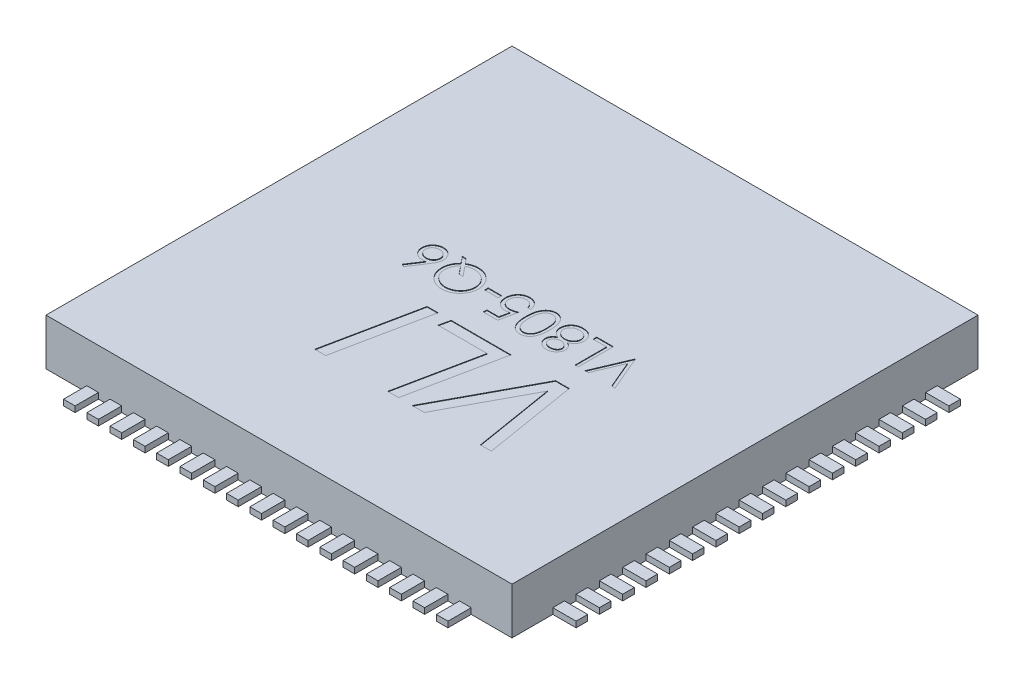
from build123d import *

# Parameters (mm, degrees)
BASES_W                = 8
BASES_H                = 8
BASE_DEPTH             = 0.8
TOPNAME_DEPTH          = 0.01
PARTNOADDITIONALS_W    = 0.230769231
PARTNOADDITIONALS_H    = 0.061538462
PARTNOADDITIONAL_DEPTH = 0.01
SOLDERCONNECTIONS_W    = 0.4
SOLDERCONNECTIONS_H    = 0.2
SOLDERCONNECTION_DEPTH = 0.1
SC_LP_COUNT            = 17
SC_LP_PITCH            = 0.4
SC_CP_COUNT            = 4
SC_CP_COPY_1_SKETCH_W  = 0.4
SC_CP_COPY_1_SKETCH_H  = 0.2
SC_CP_COPY_1_DEPTH     = 0.1
SC_CP_COPY_2_SKETCH_W  = 0.4
SC_CP_COPY_2_SKETCH_H  = 0.2
SC_CP_COPY_2_DEPTH     = 0.1
SC_CP_COPY_3_SKETCH_W  = 0.4
SC_CP_COPY_3_SKETCH_H  = 0.2
SC_CP_COPY_3_DEPTH     = 0.1
SC_CP_COPY_4_SKETCH_W  = 0.4
SC_CP_COPY_4_SKETCH_H  = 0.2
SC_CP_COPY_4_DEPTH     = 0.1
SC_CP_COPY_5_SKETCH_W  = 0.4
SC_CP_COPY_5_SKETCH_H  = 0.2
SC_CP_COPY_5_DEPTH     = 0.1
SC_CP_COPY_6_SKETCH_W  = 0.4
SC_CP_COPY_6_SKETCH_H  = 0.2
SC_CP_COPY_6_DEPTH     = 0.1
SC_CP_COPY_7_SKETCH_W  = 0.4
SC_CP_COPY_7_SKETCH_H  = 0.2
SC_CP_COPY_7_DEPTH     = 0.1
SC_CP_COPY_8_SKETCH_W  = 0.4
SC_CP_COPY_8_SKETCH_H  = 0.2
SC_CP_COPY_8_DEPTH     = 0.1
SC_CP_COPY_9_SKETCH_W  = 0.4
SC_CP_COPY_9_SKETCH_H  = 0.2
SC_CP_COPY_9_DEPTH     = 0.1
SC_CP_COPY_10_SKETCH_W = 0.4
SC_CP_COPY_10_SKETCH_H = 0.2
SC_CP_COPY_10_DEPTH    = 0.1
SC_CP_COPY_11_SKETCH_W = 0.4
SC_CP_COPY_11_SKETCH_H = 0.2
SC_CP_COPY_11_DEPTH    = 0.1
SC_CP_COPY_12_SKETCH_W = 0.4
SC_CP_COPY_12_SKETCH_H = 0.2
SC_CP_COPY_12_DEPTH    = 0.1
SC_CP_COPY_13_SKETCH_W = 0.4
SC_CP_COPY_13_SKETCH_H = 0.2
SC_CP_COPY_13_DEPTH    = 0.1
SC_CP_COPY_14_SKETCH_W = 0.4
SC_CP_COPY_14_SKETCH_H = 0.2
SC_CP_COPY_14_DEPTH    = 0.1
SC_CP_COPY_15_SKETCH_W = 0.4
SC_CP_COPY_15_SKETCH_H = 0.2
SC_CP_COPY_15_DEPTH    = 0.1
SC_CP_COPY_16_SKETCH_W = 0.4
SC_CP_COPY_16_SKETCH_H = 0.2
SC_CP_COPY_16_DEPTH    = 0.1
SC_CP_COPY_17_SKETCH_W = 0.4
SC_CP_COPY_17_SKETCH_H = 0.2
SC_CP_COPY_17_DEPTH    = 0.1
SC_CP_COPY_18_SKETCH_W = 0.4
SC_CP_COPY_18_SKETCH_H = 0.2
SC_CP_COPY_18_DEPTH    = 0.1
SC_CP_COPY_19_SKETCH_W = 0.4
SC_CP_COPY_19_SKETCH_H = 0.2
SC_CP_COPY_19_DEPTH    = 0.1
SC_CP_COPY_20_SKETCH_W = 0.4
SC_CP_COPY_20_SKETCH_H = 0.2
SC_CP_COPY_20_DEPTH    = 0.1
SC_CP_COPY_21_SKETCH_W = 0.4
SC_CP_COPY_21_SKETCH_H = 0.2
SC_CP_COPY_21_DEPTH    = 0.1
SC_CP_COPY_22_SKETCH_W = 0.4
SC_CP_COPY_22_SKETCH_H = 0.2
SC_CP_COPY_22_DEPTH    = 0.1
SC_CP_COPY_23_SKETCH_W = 0.4
SC_CP_COPY_23_SKETCH_H = 0.2
SC_CP_COPY_23_DEPTH    = 0.1
SC_CP_COPY_24_SKETCH_W = 0.4
SC_CP_COPY_24_SKETCH_H = 0.2
SC_CP_COPY_24_DEPTH    = 0.1
SC_CP_COPY_25_SKETCH_W = 0.4
SC_CP_COPY_25_SKETCH_H = 0.2
SC_CP_COPY_25_DEPTH    = 0.1
SC_CP_COPY_26_SKETCH_W = 0.4
SC_CP_COPY_26_SKETCH_H = 0.2
SC_CP_COPY_26_DEPTH    = 0.1
SC_CP_COPY_27_SKETCH_W = 0.4
SC_CP_COPY_27_SKETCH_H = 0.2
SC_CP_COPY_27_DEPTH    = 0.1
SC_CP_COPY_28_SKETCH_W = 0.4
SC_CP_COPY_28_SKETCH_H = 0.2
SC_CP_COPY_28_DEPTH    = 0.1
SC_CP_COPY_29_SKETCH_W = 0.4
SC_CP_COPY_29_SKETCH_H = 0.2
SC_CP_COPY_29_DEPTH    = 0.1
SC_CP_COPY_30_SKETCH_W = 0.4
SC_CP_COPY_30_SKETCH_H = 0.2
SC_CP_COPY_30_DEPTH    = 0.1
SC_CP_COPY_31_SKETCH_W = 0.4
SC_CP_COPY_31_SKETCH_H = 0.2
SC_CP_COPY_31_DEPTH    = 0.1
SC_CP_COPY_32_SKETCH_W = 0.4
SC_CP_COPY_32_SKETCH_H = 0.2
SC_CP_COPY_32_DEPTH    = 0.1
SC_CP_COPY_33_SKETCH_W = 0.4
SC_CP_COPY_33_SKETCH_H = 0.2
SC_CP_COPY_33_DEPTH    = 0.1
SC_CP_COPY_34_SKETCH_W = 0.4
SC_CP_COPY_34_SKETCH_H = 0.2
SC_CP_COPY_34_DEPTH    = 0.1
SC_CP_COPY_35_SKETCH_W = 0.4
SC_CP_COPY_35_SKETCH_H = 0.2
SC_CP_COPY_35_DEPTH    = 0.1
SC_CP_COPY_36_SKETCH_W = 0.4
SC_CP_COPY_36_SKETCH_H = 0.2
SC_CP_COPY_36_DEPTH    = 0.1
SC_CP_COPY_37_SKETCH_W = 0.4
SC_CP_COPY_37_SKETCH_H = 0.2
SC_CP_COPY_37_DEPTH    = 0.1
SC_CP_COPY_38_SKETCH_W = 0.4
SC_CP_COPY_38_SKETCH_H = 0.2
SC_CP_COPY_38_DEPTH    = 0.1
SC_CP_COPY_39_SKETCH_W = 0.4
SC_CP_COPY_39_SKETCH_H = 0.2
SC_CP_COPY_39_DEPTH    = 0.1
SC_CP_COPY_40_SKETCH_W = 0.4
SC_CP_COPY_40_SKETCH_H = 0.2
SC_CP_COPY_40_DEPTH    = 0.1
SC_CP_COPY_41_SKETCH_W = 0.4
SC_CP_COPY_41_SKETCH_H = 0.2
SC_CP_COPY_41_DEPTH    = 0.1
SC_CP_COPY_42_SKETCH_W = 0.4
SC_CP_COPY_42_SKETCH_H = 0.2
SC_CP_COPY_42_DEPTH    = 0.1
SC_CP_COPY_43_SKETCH_W = 0.4
SC_CP_COPY_43_SKETCH_H = 0.2
SC_CP_COPY_43_DEPTH    = 0.1
SC_CP_COPY_44_SKETCH_W = 0.4
SC_CP_COPY_44_SKETCH_H = 0.2
SC_CP_COPY_44_DEPTH    = 0.1
SC_CP_COPY_45_SKETCH_W = 0.4
SC_CP_COPY_45_SKETCH_H = 0.2
SC_CP_COPY_45_DEPTH    = 0.1
SC_CP_COPY_46_SKETCH_W = 0.4
SC_CP_COPY_46_SKETCH_H = 0.2
SC_CP_COPY_46_DEPTH    = 0.1
SC_CP_COPY_47_SKETCH_W = 0.4
SC_CP_COPY_47_SKETCH_H = 0.2
SC_CP_COPY_47_DEPTH    = 0.1
SC_CP_COPY_48_SKETCH_W = 0.4
SC_CP_COPY_48_SKETCH_H = 0.2
SC_CP_COPY_48_DEPTH    = 0.1


with BuildPart() as part:
    # BaseS → Base (new body)
    with BuildSketch(Plane(origin=(0, 0, 0), x_dir=(1, 0, 0), z_dir=(0, 1, 0))):
        Rectangle(BASES_W, BASES_H)
    extrude(amount=BASE_DEPTH)

    # TopNameS → TopName (cut)
    with BuildSketch(Plane(origin=(0, 0.8, 0), x_dir=(1, 0, 0), z_dir=(0, 1, 0))):
        Polygon((-0.669230769, -0.6), (-0.997435897, -2.2), (-1.18525641, -2.2), (-0.857051282, -0.6), align=None)
        Polygon((0.582051282, -0.6), (0.253846154, -2.2), (0.066346154, -2.2), (0.356410256, -0.784615385), (-0.484615385, -0.784615385), (-0.443589744, -0.6), align=None)
        with BuildLine():
            Line((1.582692308, -0.6), (1.845833333, -2.2))
            Line((1.845833333, -2.2), (1.658974359, -2.2))
            Line((1.658974359, -2.2), (1.501282051, -1.240064103))
            add(Edge.make_bspline(
                [(1.501282051, -1.240064103), (1.497882192, -1.219013983), (1.491253333, -1.177971615), (1.481270822, -1.118167783), (1.471926068, -1.061658816), (1.463384018, -1.008417747), (1.454955924, -0.958451018), (1.447246917, -0.91165871), (1.440328024, -0.868136506), (1.435599252, -0.840274101), (1.433333333, -0.826923077)],
                knots=[0, 0, 0, 0, 1.222255508, 2.383086792, 3.475457659, 4.505413456, 5.473947086, 6.380061867, 7.223762935, 8, 8, 8, 8], degree=3))
            add(Edge.make_bspline(
                [(1.433333333, -0.826923077), (1.424682368, -0.843057098), (1.407831804, -0.874483346), (1.383185106, -0.920334442), (1.359695574, -0.963496531), (1.337969804, -1.004460737), (1.317069979, -1.042664558), (1.297929186, -1.078667918), (1.279870901, -1.112049205), (1.26836855, -1.133542968), (1.262820513, -1.143910256)],
                knots=[0, 0, 0, 0, 1.220673892, 2.377659004, 3.470958565, 4.49719465, 5.469393223, 6.374526253, 7.21596997, 8, 8, 8, 8], degree=3))
            Line((1.262820513, -1.143910256), (0.694871795, -2.2))
            Line((0.694871795, -2.2), (0.488461538, -2.2))
            Line((0.488461538, -2.2), (1.348717949, -0.6))
            Line((1.348717949, -0.6), (1.582692308, -0.6))
        make_face()
    extrude(amount=-TOPNAME_DEPTH, mode=Mode.SUBTRACT)

    # PartNoAdditionalS → PartNoAdditional (cut)
    # profile 1 of 8: a face of its own
    with BuildSketch(Plane(origin=(0, 0.8, 0), x_dir=(1, 0, 0), z_dir=(0, 1, 0))):
        Polygon((1.969230769, -0.2), (1.911538462, -0.2), (1.711538462, 0.272836538), (1.511538462, -0.2), (1.453846154, -0.2), (1.707692308, 0.4), (1.715384615, 0.4), align=None)
    # profile 2 of 8: a face of its own
    with BuildSketch(Plane(origin=(0, 0.8, 0), x_dir=(1, 0, 0), z_dir=(0, 1, 0))):
        Polygon((1.338461538, -0.2), (1.284615385, -0.2), (1.284615385, 0.338461538), (1.053846154, 0.338461538), (1.053846154, 0.4), (1.338461538, 0.4), align=None)
    # profile 3 of 8: a face of its own
    with BuildSketch(Plane(origin=(0, 0.8, 0), x_dir=(1, 0, 0), z_dir=(0, 1, 0))):
        with BuildLine():
            add(Edge.make_bspline(
                [(0.715985577, 0.065745192), (0.71111349, 0.068305522), (0.701581569, 0.073314639), (0.688002988, 0.08140452), (0.675329538, 0.08963569), (0.663795622, 0.098304095), (0.653288162, 0.107225473), (0.643774822, 0.116376218), (0.635153293, 0.12572739), (0.627719761, 0.13551939), (0.621124306, 0.145578087), (0.615537148, 0.156027453), (0.610660977, 0.166716492), (0.60683379, 0.177807486), (0.603674009, 0.189148282), (0.601501525, 0.200891054), (0.600332782, 0.212956871), (0.60011186, 0.221111446), (0.6, 0.225240385)],
                knots=[0, 0, 0, 0, 1.264219729, 2.473363326, 3.62979159, 4.734286947, 5.785533755, 6.79450939, 7.765315851, 8.704182021, 9.615576613, 10.525715488, 11.423813905, 12.311666436, 13.218214638, 14.126256791, 15.051260205, 16, 16, 16, 16], degree=3))
            add(Edge.make_bspline(
                [(0.6, 0.225240385), (0.600131502, 0.231017388), (0.600391795, 0.242452244), (0.602682568, 0.259325102), (0.606066344, 0.275778429), (0.611206623, 0.291625708), (0.617531981, 0.307001961), (0.625513747, 0.32170003), (0.634522202, 0.336141826), (0.641766894, 0.345024578), (0.645432692, 0.349519231)],
                knots=[0, 0, 0, 0, 1.02531512, 2.029483338, 3.018748588, 4.004195107, 4.983200899, 5.966616707, 6.971112471, 8, 8, 8, 8], degree=3))
            add(Edge.make_bspline(
                [(0.645432692, 0.349519231), (0.650204659, 0.354763878), (0.659689625, 0.365188362), (0.675938127, 0.378722787), (0.69377045, 0.390096969), (0.713117592, 0.399366436), (0.733927838, 0.406581155), (0.756196753, 0.411765587), (0.779967751, 0.414735146), (0.796305832, 0.415164401), (0.8046875, 0.415384615)],
                knots=[0, 0, 0, 0, 0.954267603, 1.896743057, 2.838368354, 3.796610408, 4.779680527, 5.799409237, 6.871065594, 8, 8, 8, 8], degree=3))
            add(Edge.make_bspline(
                [(0.8046875, 0.415384615), (0.812746752, 0.415186518), (0.828429239, 0.414801039), (0.851258859, 0.412203579), (0.872565487, 0.407605081), (0.892450142, 0.401441245), (0.910720545, 0.393221623), (0.927409916, 0.383146766), (0.942762869, 0.371444131), (0.95629776, 0.357832081), (0.968310723, 0.343249423), (0.978872475, 0.328209591), (0.987601729, 0.312723533), (0.995125645, 0.297026807), (1.000724899, 0.280801364), (1.00469626, 0.264213715), (1.007190828, 0.247310982), (1.007524464, 0.235905882), (1.007692308, 0.230168269)],
                knots=[0, 0, 0, 0, 1.256864279, 2.445730223, 3.576845088, 4.651810441, 5.686528262, 6.692706664, 7.686234615, 8.689148594, 9.678739427, 10.630299996, 11.55097961, 12.448208961, 13.341360817, 14.221834469, 15.105450545, 16, 16, 16, 16], degree=3))
            add(Edge.make_bspline(
                [(1.007692308, 0.230168269), (1.007593218, 0.225958131), (1.007397382, 0.217637413), (1.006042616, 0.205344249), (1.003862723, 0.193379705), (1.000908767, 0.181696556), (0.996868717, 0.170356449), (0.992075776, 0.159300901), (0.986433334, 0.148530233), (0.979719208, 0.138208424), (0.972321981, 0.127969852), (0.963540792, 0.118322908), (0.953961079, 0.108700945), (0.943012556, 0.099689074), (0.931286526, 0.090542787), (0.918236114, 0.082026552), (0.904296473, 0.073475718), (0.8943865, 0.068366247), (0.889302885, 0.065745192)],
                knots=[0, 0, 0, 0, 0.941575622, 1.860885767, 2.762557628, 3.660168386, 4.552890429, 5.45184204, 6.353736508, 7.268493418, 8.204037487, 9.175167802, 10.182660057, 11.238220596, 12.344046335, 13.507168087, 14.721227736, 16, 16, 16, 16], degree=3))
            add(Edge.make_bspline(
                [(0.889302885, 0.065745192), (0.896252934, 0.061939639), (0.909689133, 0.054582545), (0.927650078, 0.04123413), (0.942864518, 0.026515018), (0.955170763, 0.01040306), (0.964887167, -0.006572201), (0.971756775, -0.0243214), (0.976240725, -0.042646574), (0.976694953, -0.055142523), (0.976923077, -0.061418269)],
                knots=[0, 0, 0, 0, 1.16701039, 2.256125286, 3.287752239, 4.277689688, 5.235169525, 6.160862735, 7.076343936, 8, 8, 8, 8], degree=3))
            add(Edge.make_bspline(
                [(0.976923077, -0.061418269), (0.976642221, -0.067811841), (0.976077652, -0.080664036), (0.971528169, -0.099801057), (0.964058156, -0.11860698), (0.954071862, -0.137038224), (0.941363068, -0.154254951), (0.926320434, -0.16982135), (0.908962883, -0.183334548), (0.889671928, -0.194757641), (0.868949253, -0.204099212), (0.847048108, -0.210476562), (0.824358825, -0.214670951), (0.808913213, -0.215144506), (0.801081731, -0.215384615)],
                knots=[0, 0, 0, 0, 0.888724595, 1.786491426, 2.720083884, 3.697804067, 4.69440576, 5.687697823, 6.7000873, 7.744853364, 8.800284131, 9.853047784, 10.91141782, 12, 12, 12, 12], degree=3))
            add(Edge.make_bspline(
                [(0.801081731, -0.215384615), (0.793452221, -0.215137742), (0.778407696, -0.214650936), (0.756260764, -0.210550742), (0.735052168, -0.203779522), (0.714900772, -0.194557097), (0.696235355, -0.183065684), (0.679624862, -0.169403776), (0.664933692, -0.15400699), (0.652796135, -0.136733479), (0.643059249, -0.118303464), (0.636047571, -0.099185454), (0.63161473, -0.079608644), (0.631051448, -0.066368959), (0.630769231, -0.059735577)],
                knots=[0, 0, 0, 0, 1.072634126, 2.115112298, 3.156050586, 4.19761425, 5.225177188, 6.230426315, 7.215180151, 8.209739481, 9.190420596, 10.139012357, 11.067603024, 12, 12, 12, 12], degree=3))
            add(Edge.make_bspline(
                [(0.630769231, -0.059735577), (0.631016643, -0.053225863), (0.631502547, -0.040441155), (0.635536223, -0.021830867), (0.64243506, -0.004438039), (0.651741614, 0.012004966), (0.663956678, 0.027235391), (0.678833619, 0.041328874), (0.696179391, 0.054561054), (0.709235938, 0.061933813), (0.715985577, 0.065745192)],
                knots=[0, 0, 0, 0, 0.975463758, 1.915755378, 2.838359076, 3.772025586, 4.738400888, 5.753889765, 6.838863581, 8, 8, 8, 8], degree=3))
        make_face()
        with BuildLine():
            add(Edge.make_bspline(
                [(0.804086538, -0.153846154), (0.808295395, -0.15373484), (0.816529759, -0.153517061), (0.828601185, -0.152370517), (0.840089575, -0.150168185), (0.851057751, -0.147151019), (0.861543286, -0.143397061), (0.871305729, -0.138451094), (0.880673152, -0.13295363), (0.889338249, -0.126505356), (0.897182362, -0.119470149), (0.904188538, -0.112122984), (0.909896397, -0.104247269), (0.914807077, -0.096237015), (0.918453943, -0.087759978), (0.921044551, -0.079001765), (0.922877945, -0.069906902), (0.923010081, -0.063711087), (0.923076923, -0.060576923)],
                knots=[0, 0, 0, 0, 1.20353747, 2.354645537, 3.462130888, 4.543058862, 5.604822423, 6.639552563, 7.666902586, 8.706944258, 9.720926464, 10.677177239, 11.602682187, 12.496457588, 13.358248655, 14.231532794, 15.105417644, 16, 16, 16, 16], degree=3))
            add(Edge.make_bspline(
                [(0.923076923, -0.060576923), (0.922955019, -0.057444533), (0.92271412, -0.051254481), (0.920970485, -0.042076865), (0.918055112, -0.033175462), (0.914057508, -0.024467174), (0.908927332, -0.015974355), (0.90270083, -0.00766446), (0.895107837, 0.000242762), (0.88672288, 0.007971655), (0.877563799, 0.015092398), (0.867939272, 0.021453035), (0.857779056, 0.026523679), (0.847387428, 0.030969598), (0.836544629, 0.034304552), (0.825325421, 0.036707191), (0.813741789, 0.038193372), (0.805893822, 0.038371442), (0.801923077, 0.038461538)],
                knots=[0, 0, 0, 0, 0.873213166, 1.72559466, 2.594724523, 3.479581045, 4.391597569, 5.35687048, 6.368548091, 7.443976143, 8.534559525, 9.600545123, 10.654815915, 11.696401765, 12.749428718, 13.812189468, 14.893058657, 16, 16, 16, 16], degree=3))
            add(Edge.make_bspline(
                [(0.801923077, 0.038461538), (0.796822754, 0.038312659), (0.786672483, 0.03801637), (0.771714827, 0.035236439), (0.757134569, 0.030918943), (0.743207591, 0.024791038), (0.730183153, 0.01731965), (0.718428599, 0.008508792), (0.708435835, -0.001848451), (0.699934536, -0.013151281), (0.693287723, -0.025140854), (0.688196161, -0.037221928), (0.68519768, -0.049494014), (0.684807902, -0.057717255), (0.684615385, -0.061778846)],
                knots=[0, 0, 0, 0, 1.076561449, 2.142489767, 3.202892658, 4.283174188, 5.348766409, 6.369549039, 7.375093932, 8.378927502, 9.349008457, 10.26378795, 11.142457041, 12, 12, 12, 12], degree=3))
            add(Edge.make_bspline(
                [(0.684615385, -0.061778846), (0.684704881, -0.064629964), (0.684882517, -0.070289025), (0.686405644, -0.078673297), (0.688781258, -0.086872056), (0.69224405, -0.094837173), (0.69643295, -0.102753684), (0.701772438, -0.110373241), (0.707960599, -0.117926433), (0.715086769, -0.125164643), (0.723137871, -0.131960069), (0.732179033, -0.137850639), (0.742130469, -0.142762719), (0.752858765, -0.146889473), (0.764477295, -0.149954448), (0.776886027, -0.152260953), (0.790196926, -0.153558306), (0.799356251, -0.153748123), (0.804086538, -0.153846154)],
                knots=[0, 0, 0, 0, 0.814035228, 1.61574325, 2.427118093, 3.24780647, 4.092880925, 4.981933388, 5.900917883, 6.880367106, 7.87994501, 8.905470125, 9.95492938, 11.0455354, 12.184050453, 13.382997595, 14.64846247, 16, 16, 16, 16], degree=3))
        make_face(mode=Mode.SUBTRACT)
        with BuildLine():
            add(Edge.make_bspline(
                [(0.800600962, 0.1), (0.805936796, 0.100094937), (0.816404401, 0.10028118), (0.831740081, 0.102353282), (0.846457013, 0.105239718), (0.860510017, 0.109611378), (0.873826957, 0.115299502), (0.886595245, 0.122044643), (0.898614934, 0.13012936), (0.909832299, 0.139357609), (0.920102098, 0.14935804), (0.929144799, 0.159919831), (0.936784599, 0.170899567), (0.942984383, 0.182311134), (0.947794011, 0.194129389), (0.951343591, 0.20636123), (0.953404472, 0.219040776), (0.953698106, 0.227636996), (0.953846154, 0.231971154)],
                knots=[0, 0, 0, 0, 1.140332253, 2.237053636, 3.304055028, 4.344690294, 5.377465719, 6.397042765, 7.428360044, 8.469453732, 9.499453352, 10.490108612, 11.438398528, 12.354680514, 13.261581007, 14.161901135, 15.073242693, 16, 16, 16, 16], degree=3))
            add(Edge.make_bspline(
                [(0.953846154, 0.231971154), (0.953608134, 0.237358368), (0.953134179, 0.248085597), (0.949508982, 0.263899438), (0.943555361, 0.279204427), (0.935203133, 0.293784711), (0.925015367, 0.307463512), (0.91263015, 0.319554707), (0.898349448, 0.32989553), (0.882290582, 0.338538336), (0.86468692, 0.345383556), (0.845647251, 0.350280844), (0.825300542, 0.353358996), (0.81126931, 0.353681209), (0.804086538, 0.353846154)],
                knots=[0, 0, 0, 0, 0.899105568, 1.790333855, 2.694925079, 3.632758987, 4.588257081, 5.534574046, 6.511571685, 7.523527334, 8.572244311, 9.657983075, 10.801090915, 12, 12, 12, 12], degree=3))
            add(Edge.make_bspline(
                [(0.804086538, 0.353846154), (0.798472579, 0.353737099), (0.787534785, 0.353524626), (0.771571804, 0.35168818), (0.756543053, 0.348688389), (0.742304553, 0.344620994), (0.728962282, 0.339229305), (0.716534428, 0.332532311), (0.704851758, 0.324882897), (0.694413565, 0.315826651), (0.684922681, 0.306135908), (0.676609415, 0.295931235), (0.669573836, 0.285314834), (0.663902483, 0.274292917), (0.659398887, 0.262905991), (0.656152307, 0.251107311), (0.654151348, 0.238850533), (0.653948816, 0.230536468), (0.653846154, 0.226322115)],
                knots=[0, 0, 0, 0, 1.224631902, 2.385975653, 3.500340538, 4.565441647, 5.612488581, 6.63322211, 7.641830068, 8.652595074, 9.641693811, 10.598750962, 11.520088299, 12.415429315, 13.298523938, 14.187139574, 15.081071174, 16, 16, 16, 16], degree=3))
            add(Edge.make_bspline(
                [(0.653846154, 0.226322115), (0.654000416, 0.222228391), (0.654304595, 0.214156281), (0.656262907, 0.202203065), (0.659624682, 0.190607433), (0.664526716, 0.179421683), (0.670546663, 0.168515698), (0.677983219, 0.157981033), (0.686745746, 0.147788519), (0.696812797, 0.138148009), (0.707723207, 0.129235795), (0.71928586, 0.121315705), (0.731553449, 0.114842543), (0.74428296, 0.109404631), (0.757602716, 0.105166831), (0.771448473, 0.102195231), (0.785846459, 0.100327582), (0.795627231, 0.100110427), (0.800600962, 0.1)],
                knots=[0, 0, 0, 0, 0.917336384, 1.808827106, 2.706624561, 3.615530867, 4.539869921, 5.493819324, 6.499753197, 7.547410123, 8.613069608, 9.653934021, 10.682176708, 11.716048074, 12.752411263, 13.808993382, 14.885826486, 16, 16, 16, 16], degree=3))
        make_face(mode=Mode.SUBTRACT)
    # profile 4 of 8: a face of its own
    with BuildSketch(Plane(origin=(0, 0.8, 0), x_dir=(1, 0, 0), z_dir=(0, 1, 0))):
        with BuildLine():
            add(Edge.make_bspline(
                [(0.546153846, 0.100240385), (0.546097614, 0.09062369), (0.545988384, 0.071943121), (0.544773226, 0.044722897), (0.542754596, 0.019186847), (0.539988188, -0.00466625), (0.536621679, -0.026842554), (0.53212759, -0.047282792), (0.527016844, -0.066081602), (0.521093498, -0.083300172), (0.514410119, -0.099170865), (0.50713482, -0.113985804), (0.498983885, -0.127727292), (0.490405584, -0.140597792), (0.481099694, -0.152467781), (0.471098575, -0.163283912), (0.460490319, -0.173213797), (0.449224729, -0.182094152), (0.437409182, -0.189832196), (0.425393195, -0.196846558), (0.41283405, -0.202395113), (0.400041524, -0.207139765), (0.38691255, -0.210898172), (0.37344141, -0.213512438), (0.359616014, -0.215147979), (0.350285069, -0.215304988), (0.345552885, -0.215384615)],
                knots=[0, 0, 0, 0, 1.64625301, 3.197870201, 4.6634513, 6.030635694, 7.308242971, 8.501545196, 9.611429483, 10.641742253, 11.616230371, 12.55791849, 13.464870342, 14.34944951, 15.20427819, 16.044004467, 16.869007726, 17.689551165, 18.496129964, 19.285613293, 20.0683943, 20.843080271, 21.620342827, 22.403213977, 23.190190624, 24, 24, 24, 24], degree=3))
            add(Edge.make_bspline(
                [(0.345552885, -0.215384615), (0.340778774, -0.215318401), (0.331279975, -0.215186658), (0.317287092, -0.213332295), (0.303537942, -0.210938815), (0.290241125, -0.207100066), (0.277145225, -0.202506506), (0.264575911, -0.196445377), (0.252089419, -0.189853428), (0.240252993, -0.181811804), (0.228712984, -0.172924487), (0.21789543, -0.16283511), (0.207523806, -0.151822898), (0.197989843, -0.139642246), (0.188884931, -0.126479919), (0.1805547, -0.112225581), (0.172825897, -0.096910819), (0.16555324, -0.080606631), (0.159193494, -0.062877507), (0.153539171, -0.043834029), (0.148904497, -0.023303747), (0.145071703, -0.00140103), (0.142096725, 0.021982629), (0.139931587, 0.046799852), (0.138787499, 0.073066165), (0.138572083, 0.091024659), (0.138461538, 0.100240385)],
                knots=[0, 0, 0, 0, 0.810910589, 1.61342667, 2.396193133, 3.181089899, 3.963115317, 4.752255436, 5.550715454, 6.36105385, 7.181178335, 8.024612154, 8.872680183, 9.750181803, 10.651284446, 11.591556747, 12.554036451, 13.566402641, 14.62422919, 15.753422176, 16.94128843, 18.199818041, 19.531985927, 20.947085226, 22.433341622, 24, 24, 24, 24], degree=3))
            add(Edge.make_bspline(
                [(0.138461538, 0.100240385), (0.138574653, 0.109415797), (0.138795545, 0.127333733), (0.139905549, 0.153483565), (0.142154766, 0.178165367), (0.144896154, 0.201414898), (0.1488487, 0.223201766), (0.153249064, 0.243642977), (0.158861976, 0.262546459), (0.16507087, 0.280123613), (0.172242332, 0.296358734), (0.179912929, 0.311610282), (0.188367511, 0.325783724), (0.197297717, 0.33902948), (0.207012176, 0.351105668), (0.217243441, 0.362241065), (0.228165942, 0.372347971), (0.239765356, 0.381340223), (0.251713658, 0.389442423), (0.264202584, 0.396269421), (0.276939782, 0.402221171), (0.290057734, 0.407005681), (0.303472792, 0.410787855), (0.317233264, 0.41336255), (0.331281846, 0.415177386), (0.3407794, 0.4153153), (0.345552885, 0.415384615)],
                knots=[0, 0, 0, 0, 1.561431216, 3.049195289, 4.452146966, 5.778046447, 7.031138842, 8.218704273, 9.334037798, 10.384210803, 11.388620812, 12.352076869, 13.287433199, 14.19507451, 15.06813243, 15.922055533, 16.766344942, 17.596869952, 18.417486629, 19.220035357, 20.016159057, 20.807716045, 21.59340902, 22.384936649, 23.188266813, 24, 24, 24, 24], degree=3))
            add(Edge.make_bspline(
                [(0.345552885, 0.415384615), (0.350284904, 0.415304283), (0.359615524, 0.415145882), (0.373443302, 0.413520534), (0.38689491, 0.41087014), (0.39999724, 0.407270918), (0.412777102, 0.402696519), (0.425109318, 0.396878059), (0.437156706, 0.390129525), (0.448864472, 0.382451903), (0.460008798, 0.373653174), (0.470656117, 0.363923452), (0.480527743, 0.353011992), (0.489769456, 0.341092949), (0.498418934, 0.328190049), (0.506535352, 0.314343362), (0.513788495, 0.2993841), (0.520623412, 0.283427252), (0.526648443, 0.266082164), (0.531909389, 0.247218934), (0.536344845, 0.226708896), (0.539877747, 0.20455107), (0.542771982, 0.180779756), (0.544771236, 0.155357074), (0.545987776, 0.128337477), (0.546097479, 0.10977699), (0.546153846, 0.100240385)],
                knots=[0, 0, 0, 0, 0.810976328, 1.599087026, 2.383086309, 3.159618043, 3.926613167, 4.707144544, 5.494386734, 6.292609454, 7.104690378, 7.92621526, 8.762510248, 9.62398222, 10.509836085, 11.424023232, 12.373226806, 13.358118208, 14.398657954, 15.5185989, 16.713620699, 17.994156382, 19.364120462, 20.818119981, 22.365111093, 24, 24, 24, 24], degree=3))
        make_face()
        with BuildLine():
            add(Edge.make_bspline(
                [(0.492307692, 0.1), (0.492286767, 0.108014031), (0.492246154, 0.12356769), (0.491215884, 0.146129889), (0.489781854, 0.167209009), (0.48797776, 0.186796823), (0.485275876, 0.204824875), (0.482210416, 0.221368105), (0.478533608, 0.23639592), (0.474161754, 0.250039555), (0.46918205, 0.262492509), (0.463753731, 0.274085667), (0.457873689, 0.284960044), (0.451407017, 0.295076404), (0.444261067, 0.304378245), (0.436595338, 0.312909745), (0.428365258, 0.320636166), (0.416974843, 0.329805862), (0.402010524, 0.339393109), (0.38305971, 0.347639053), (0.363578312, 0.352854598), (0.350351775, 0.353516018), (0.34375, 0.353846154)],
                knots=[0, 0, 0, 0, 1.459193451, 2.832007961, 4.111736495, 5.306635028, 6.412683014, 7.430020708, 8.369596877, 9.227877302, 10.036669781, 10.810175692, 11.557788084, 12.286326232, 12.994037279, 13.69140682, 14.37267704, 15.047194847, 16.352618509, 17.594157723, 18.799169539, 20, 20, 20, 20], degree=3))
            add(Edge.make_bspline(
                [(0.34375, 0.353846154), (0.337110317, 0.35355667), (0.323854503, 0.35297873), (0.304386365, 0.347934696), (0.285642967, 0.339734698), (0.270850876, 0.330366394), (0.259628545, 0.321387533), (0.251584963, 0.313741016), (0.244203084, 0.305176678), (0.237201533, 0.295936931), (0.230779992, 0.285844468), (0.224940593, 0.274948037), (0.21961202, 0.263217318), (0.216576183, 0.25502822), (0.215024038, 0.250841346)],
                knots=[0, 0, 0, 0, 1.353621445, 2.702441307, 4.075953605, 5.516772412, 6.261413105, 7.007624062, 7.778524365, 8.566925914, 9.372323995, 10.217594641, 11.088702136, 12, 12, 12, 12], degree=3))
            add(Edge.make_bspline(
                [(0.215024038, 0.250841346), (0.213215164, 0.245487677), (0.209542373, 0.234617431), (0.204808926, 0.217755091), (0.201081143, 0.200063188), (0.197727423, 0.181647454), (0.195438328, 0.162372077), (0.193595846, 0.142296697), (0.192510585, 0.121406178), (0.192376057, 0.10721275), (0.192307692, 0.1)],
                knots=[0, 0, 0, 0, 0.884706709, 1.796334032, 2.740027952, 3.714592787, 4.726048262, 5.777819803, 6.87074269, 8, 8, 8, 8], degree=3))
            add(Edge.make_bspline(
                [(0.192307692, 0.1), (0.192383091, 0.092787405), (0.192530604, 0.078676281), (0.193499782, 0.058031694), (0.195057171, 0.038389521), (0.197165062, 0.019731943), (0.20005875, 0.002092169), (0.203533784, -0.014555042), (0.207607856, -0.03020521), (0.212280959, -0.044898667), (0.217547407, -0.058582699), (0.223365511, -0.071286762), (0.229573322, -0.083079375), (0.236320342, -0.093922607), (0.243511114, -0.103879731), (0.251403833, -0.112721539), (0.25949716, -0.12087816), (0.271007583, -0.130022334), (0.285954215, -0.139419481), (0.304681168, -0.147832062), (0.324062756, -0.152810855), (0.337192317, -0.153501303), (0.34375, -0.153846154)],
                knots=[0, 0, 0, 0, 1.313528337, 2.569860077, 3.762944266, 4.901481389, 5.988248151, 7.017139294, 7.997571128, 8.932104357, 9.823695246, 10.66607014, 11.475539426, 12.248954257, 12.990316782, 13.708962568, 14.405488541, 15.08007697, 16.381737273, 17.610043218, 18.806313575, 20, 20, 20, 20], degree=3))
            add(Edge.make_bspline(
                [(0.34375, -0.153846154), (0.350387389, -0.153500895), (0.363674258, -0.152809748), (0.3832586, -0.147849628), (0.402097661, -0.139479314), (0.417012796, -0.130010713), (0.428361175, -0.120913672), (0.436436885, -0.11314954), (0.444058247, -0.104697827), (0.451169964, -0.095438161), (0.457597181, -0.085341091), (0.46354869, -0.074545547), (0.4689337, -0.06296961), (0.473932201, -0.05052354), (0.478257667, -0.036857485), (0.482146765, -0.021832667), (0.485148564, -0.005181849), (0.487813897, 0.012930862), (0.489828586, 0.032541965), (0.49120589, 0.053670984), (0.492249283, 0.076311833), (0.492287833, 0.091945797), (0.492307692, 0.1)],
                knots=[0, 0, 0, 0, 1.207779899, 2.417760083, 3.652287919, 4.947299644, 5.621638849, 6.297435916, 6.984320042, 7.691843698, 8.42018894, 9.161205785, 9.934506883, 10.743085206, 11.601138371, 12.542248028, 13.566483018, 14.679455109, 15.87477181, 17.154161492, 18.533899613, 20, 20, 20, 20], degree=3))
        make_face(mode=Mode.SUBTRACT)
    # profile 5 of 8: a face of its own
    with BuildSketch(Plane(origin=(0, 0.8, 0), x_dir=(1, 0, 0), z_dir=(0, 1, 0))):
        with BuildLine():
            Line((-0.292307692, -0.2), (-0.292307692, -0.138461538))
            Line((-0.292307692, -0.138461538), (-0.088221154, -0.138461538))
            Line((-0.088221154, -0.138461538), (-0.055889423, 0.019350962))
            add(Edge.make_bspline(
                [(-0.055889423, 0.019350962), (-0.062241859, 0.017597201), (-0.074548698, 0.014199566), (-0.092713246, 0.010427149), (-0.109957623, 0.008153072), (-0.121147687, 0.007842562), (-0.1265625, 0.007692308)],
                knots=[0, 0, 0, 0, 1.100273476, 2.13160584, 3.095893838, 4, 4, 4, 4], degree=3))
            add(Edge.make_bspline(
                [(-0.1265625, 0.007692308), (-0.133263776, 0.007832574), (-0.14644016, 0.008108373), (-0.165689227, 0.010912604), (-0.184155577, 0.014977047), (-0.201573596, 0.021228935), (-0.218224099, 0.028912811), (-0.233881345, 0.038465207), (-0.248618883, 0.049750007), (-0.262404499, 0.062535717), (-0.274832716, 0.076771204), (-0.285675668, 0.09208986), (-0.294943792, 0.108320751), (-0.302337009, 0.125613174), (-0.308331292, 0.143804166), (-0.312294719, 0.163046369), (-0.314939101, 0.183179688), (-0.315234156, 0.196946275), (-0.315384615, 0.203966346)],
                knots=[0, 0, 0, 0, 1.052656913, 2.069786496, 3.052102726, 4.020122636, 4.972424848, 5.930457368, 6.896570172, 7.885826804, 8.881139003, 9.861434336, 10.831623367, 11.813212553, 12.812997731, 13.836986694, 14.897002833, 16, 16, 16, 16], degree=3))
            add(Edge.make_bspline(
                [(-0.315384615, 0.203966346), (-0.315270515, 0.208855846), (-0.315043857, 0.218568767), (-0.313893379, 0.232993841), (-0.311671064, 0.247111867), (-0.308719389, 0.260894882), (-0.304794495, 0.274363454), (-0.300153112, 0.287549361), (-0.294597689, 0.300430788), (-0.288258192, 0.31294364), (-0.281045507, 0.32484163), (-0.273347951, 0.336263397), (-0.264960286, 0.346877583), (-0.256029345, 0.356861606), (-0.246383645, 0.365928308), (-0.236259892, 0.37445591), (-0.225431698, 0.382082701), (-0.214089957, 0.389097159), (-0.202242624, 0.395377757), (-0.189769352, 0.400616865), (-0.176944021, 0.405208998), (-0.163652304, 0.408943342), (-0.149919955, 0.411840654), (-0.135699685, 0.413813684), (-0.121062849, 0.415249235), (-0.111141438, 0.415339181), (-0.106129808, 0.415384615)],
                knots=[0, 0, 0, 0, 1.056281413, 2.098288097, 3.122646807, 4.141030392, 5.140675379, 6.150604744, 7.15845591, 8.168533554, 9.177684096, 10.161739049, 11.141561652, 12.097360316, 13.052218386, 13.998410789, 14.954052752, 15.909851415, 16.877523809, 17.846742625, 18.829312613, 19.818263486, 20.826374662, 21.858017533, 22.918014209, 24, 24, 24, 24], degree=3))
            add(Edge.make_bspline(
                [(-0.106129808, 0.415384615), (-0.100151537, 0.415265857), (-0.088389994, 0.415032214), (-0.071155618, 0.412599449), (-0.054584295, 0.409091368), (-0.038744753, 0.403896746), (-0.023711483, 0.397084835), (-0.00926641, 0.389043319), (0.004326047, 0.379337527), (0.017162322, 0.368315408), (0.028937437, 0.356090496), (0.039777757, 0.343093575), (0.049164116, 0.329036378), (0.057319936, 0.314153424), (0.064257903, 0.298405913), (0.069713157, 0.281757293), (0.074114816, 0.264288437), (0.075977164, 0.25226216), (0.076923077, 0.246153846)],
                knots=[0, 0, 0, 0, 1.04695683, 2.059763882, 3.044413726, 4.012427942, 4.974081556, 5.932886124, 6.904940154, 7.895678616, 8.893654631, 9.876199664, 10.857615262, 11.850515636, 12.847107701, 13.868396357, 14.917328757, 16, 16, 16, 16], degree=3))
            Line((0.076923077, 0.246153846), (0.023076923, 0.246153846))
            add(Edge.make_bspline(
                [(0.023076923, 0.246153846), (0.021753691, 0.251876672), (0.019210365, 0.262876261), (0.013598672, 0.278312067), (0.006845951, 0.292124439), (-0.001556053, 0.304226515), (-0.011099828, 0.315025652), (-0.022114891, 0.324629033), (-0.034507634, 0.333188475), (-0.048280827, 0.340381489), (-0.062848604, 0.346431684), (-0.078006363, 0.350751457), (-0.093538871, 0.353365801), (-0.103996446, 0.353685434), (-0.109254808, 0.353846154)],
                knots=[0, 0, 0, 0, 1.136370375, 2.184166959, 3.172867797, 4.104539607, 5.027679118, 5.956634301, 6.927059835, 7.936867459, 8.959641981, 9.976160943, 10.98235693, 12, 12, 12, 12], degree=3))
            add(Edge.make_bspline(
                [(-0.109254808, 0.353846154), (-0.114390105, 0.353704272), (-0.124501548, 0.353424905), (-0.139389749, 0.351309389), (-0.153721736, 0.34796567), (-0.167522949, 0.343281311), (-0.180725572, 0.337084179), (-0.193310938, 0.329471359), (-0.205458337, 0.320632784), (-0.216848067, 0.310530616), (-0.227277137, 0.299391698), (-0.236492616, 0.287481616), (-0.244168621, 0.274775785), (-0.250637335, 0.261494696), (-0.255549327, 0.247492652), (-0.259053495, 0.232835309), (-0.261111162, 0.217486455), (-0.261394222, 0.20701743), (-0.261538462, 0.201682692)],
                knots=[0, 0, 0, 0, 1.027268864, 2.022700798, 3.002744649, 3.968653148, 4.933396556, 5.915045722, 6.907600446, 7.935526002, 8.956456544, 9.95700807, 10.942805781, 11.92166854, 12.907987664, 13.905483474, 14.932689774, 16, 16, 16, 16], degree=3))
            add(Edge.make_bspline(
                [(-0.261538462, 0.201682692), (-0.261447292, 0.196866218), (-0.261269489, 0.187472963), (-0.259166746, 0.173743077), (-0.256334516, 0.160637145), (-0.251867579, 0.148277619), (-0.246441853, 0.136535467), (-0.239372357, 0.125700823), (-0.23155657, 0.115243917), (-0.222196631, 0.105856072), (-0.212061974, 0.097119123), (-0.200830945, 0.089708962), (-0.188824502, 0.083404294), (-0.176014666, 0.078239506), (-0.162387217, 0.074125147), (-0.147934382, 0.07128171), (-0.132652988, 0.069580227), (-0.12220002, 0.069349413), (-0.116826923, 0.069230769)],
                knots=[0, 0, 0, 0, 1.045820996, 2.039596555, 3.013371638, 3.9552447, 4.890047302, 5.817684688, 6.761648481, 7.722253242, 8.692244539, 9.66551337, 10.63924952, 11.635311376, 12.662847378, 13.728455105, 14.832366986, 16, 16, 16, 16], degree=3))
            add(Edge.make_bspline(
                [(-0.116826923, 0.069230769), (-0.112135862, 0.069326919), (-0.102532532, 0.069523754), (-0.087767428, 0.071072798), (-0.072319039, 0.073455854), (-0.05612739, 0.076890598), (-0.039236916, 0.081191135), (-0.021619528, 0.086561965), (-0.0032748, 0.092748485), (0.009072515, 0.09754696), (0.015384615, 0.1)],
                knots=[0, 0, 0, 0, 0.824638674, 1.688163388, 2.607705698, 3.571998603, 4.597075385, 5.671199175, 6.809488238, 8, 8, 8, 8], degree=3))
            Line((0.015384615, 0.1), (-0.046153846, -0.2))
            Line((-0.046153846, -0.2), (-0.292307692, -0.2))
        make_face()
    # profile 6 of 8: a face of its own
    with BuildSketch(Plane(origin=(0, 0.8, 0), x_dir=(1, 0, 0), z_dir=(0, 1, 0))):
        with Locations((-0.492307693, 0.169230769)):
            Rectangle(PARTNOADDITIONALS_W, PARTNOADDITIONALS_H)
    # profile 7 of 8: a face of its own
    with BuildSketch(Plane(origin=(0, 0.8, 0), x_dir=(1, 0, 0), z_dir=(0, 1, 0))):
        with BuildLine():
            Line((-1.2078125, 0.333173077), (-1.3, 0.446153846))
            Line((-1.3, 0.446153846), (-1.2328125, 0.446153846))
            Line((-1.2328125, 0.446153846), (-1.166225962, 0.364663462))
            add(Edge.make_bspline(
                [(-1.166225962, 0.364663462), (-1.159547218, 0.368720611), (-1.14631276, 0.376760175), (-1.125684089, 0.387143391), (-1.104606728, 0.395708218), (-1.08327226, 0.403075679), (-1.061461704, 0.408535635), (-1.039305538, 0.412558161), (-1.016754578, 0.414839732), (-1.001607376, 0.415202295), (-0.993990385, 0.415384615)],
                knots=[0, 0, 0, 0, 1.030168789, 2.04136103, 3.041061446, 4.02840172, 5.015006777, 6.002573162, 6.995564809, 8, 8, 8, 8], degree=3))
            add(Edge.make_bspline(
                [(-0.993990385, 0.415384615), (-0.983077365, 0.41512127), (-0.961603791, 0.414603085), (-0.930063462, 0.410094523), (-0.899764586, 0.40308667), (-0.870785008, 0.393083195), (-0.843176772, 0.380098368), (-0.816855076, 0.364252092), (-0.79181069, 0.345574674), (-0.768426735, 0.324246809), (-0.747045456, 0.301042544), (-0.728284472, 0.276250496), (-0.71233263, 0.250281269), (-0.6994346, 0.22300557), (-0.689198293, 0.194660798), (-0.682222527, 0.165011234), (-0.677707195, 0.134233373), (-0.677187018, 0.113277401), (-0.676923077, 0.102644231)],
                knots=[0, 0, 0, 0, 1.05574053, 2.077383083, 3.077194498, 4.061905691, 5.03852134, 6.024727803, 7.030589082, 8.057245348, 9.083652609, 10.080210343, 11.061793968, 12.027891381, 12.99559829, 13.972775731, 14.971375788, 16, 16, 16, 16], degree=3))
            add(Edge.make_bspline(
                [(-0.676923077, 0.102644231), (-0.677015994, 0.095507249), (-0.677201174, 0.08128343), (-0.679384875, 0.060180454), (-0.682550041, 0.039450369), (-0.687183396, 0.019144375), (-0.693034118, -0.000785069), (-0.700295323, -0.020328033), (-0.708845224, -0.039479317), (-0.71867629, -0.058125665), (-0.72953519, -0.076107807), (-0.74149162, -0.093111863), (-0.754377044, -0.109132262), (-0.768188416, -0.124193041), (-0.783049487, -0.138164773), (-0.798780153, -0.151143851), (-0.815473822, -0.163128504), (-0.833044756, -0.173967521), (-0.851286961, -0.183739161), (-0.870085167, -0.192094422), (-0.889209606, -0.199433468), (-0.908900414, -0.205121574), (-0.928953005, -0.209750132), (-0.949482545, -0.212923414), (-0.970425164, -0.215114609), (-0.984569565, -0.215294064), (-0.991706731, -0.215384615)],
                knots=[0, 0, 0, 0, 1.030626684, 2.05401234, 3.061696819, 4.058602899, 5.06035271, 6.060211399, 7.068045458, 8.088070503, 9.103503967, 10.100645233, 11.088606638, 12.071673413, 13.05021482, 14.032855563, 15.015837146, 16.016466104, 17.013321779, 18.002943197, 18.986537994, 19.969996554, 20.961258309, 21.957508933, 22.969373316, 24, 24, 24, 24], degree=3))
            add(Edge.make_bspline(
                [(-0.991706731, -0.215384615), (-1.00261995, -0.215123039), (-1.024054211, -0.214609286), (-1.05551414, -0.210093621), (-1.085695249, -0.203089913), (-1.114583113, -0.193057965), (-1.142157013, -0.180096363), (-1.168419795, -0.164315121), (-1.193332194, -0.145614445), (-1.216710859, -0.124403165), (-1.237922131, -0.101024502), (-1.256622836, -0.076112106), (-1.272403971, -0.049849309), (-1.285365969, -0.022275462), (-1.295396426, 0.006612599), (-1.30241482, 0.036831664), (-1.30690892, 0.068334889), (-1.307428337, 0.089808245), (-1.307692308, 0.100721154)],
                knots=[0, 0, 0, 0, 1.050572733, 2.063392076, 3.054553589, 4.030798755, 5.002633919, 5.98401295, 6.976458006, 7.99808884, 9.019719675, 10.012164731, 10.993543762, 11.965378925, 12.941624092, 13.932785605, 14.949427267, 16, 16, 16, 16], degree=3))
            add(Edge.make_bspline(
                [(-1.307692308, 0.100721154), (-1.307406732, 0.112076902), (-1.306845162, 0.134407338), (-1.301984256, 0.167091177), (-1.294390896, 0.198362702), (-1.283314579, 0.228113314), (-1.269192482, 0.256532835), (-1.251812745, 0.283566338), (-1.23151694, 0.309492873), (-1.215797193, 0.325196548), (-1.2078125, 0.333173077)],
                knots=[0, 0, 0, 0, 1.045555185, 2.056025074, 3.037071613, 4.005098777, 4.973948731, 5.954752269, 6.961136269, 8, 8, 8, 8], degree=3))
        make_face()
        with BuildLine():
            add(Edge.make_bspline(
                [(-1.171634615, 0.288822115), (-1.17818075, 0.282173372), (-1.191057288, 0.269094999), (-1.207772683, 0.247651245), (-1.222098141, 0.225375454), (-1.233704333, 0.20198451), (-1.242767734, 0.177659216), (-1.249127577, 0.15230435), (-1.253080507, 0.126045896), (-1.253589062, 0.108186964), (-1.253846154, 0.099158654)],
                knots=[0, 0, 0, 0, 1.052185505, 2.069695543, 3.06176622, 4.036333774, 5.010523718, 5.985353414, 6.981526144, 8, 8, 8, 8], degree=3))
            add(Edge.make_bspline(
                [(-1.253846154, 0.099158654), (-1.253779107, 0.093344408), (-1.253646568, 0.081850669), (-1.251824158, 0.064841952), (-1.24924599, 0.048208894), (-1.245513593, 0.031981215), (-1.240707183, 0.016191792), (-1.234770844, 0.00086206), (-1.227820237, -0.014057436), (-1.219717348, -0.028474017), (-1.210784598, -0.042366788), (-1.200841351, -0.055565847), (-1.190027565, -0.068003136), (-1.178461375, -0.079883615), (-1.165919784, -0.090962384), (-1.152447773, -0.101234694), (-1.138211345, -0.110949132), (-1.123140055, -0.119717667), (-1.107609094, -0.127778966), (-1.091709341, -0.134759552), (-1.075574302, -0.140671858), (-1.059228961, -0.145465979), (-1.042694471, -0.149239563), (-1.025941842, -0.151814846), (-1.009014397, -0.15363538), (-0.997641059, -0.153775836), (-0.991947115, -0.153846154)],
                knots=[0, 0, 0, 0, 1.032958288, 2.041976502, 3.037103433, 4.023477888, 4.998866292, 5.968231228, 6.943073582, 7.921783703, 8.90545537, 9.876780072, 10.85618943, 11.833110341, 12.821898168, 13.827467856, 14.842673888, 15.88323808, 16.924703457, 17.951432745, 18.967462636, 19.976958182, 20.977218729, 21.979378626, 22.98839684, 24, 24, 24, 24], degree=3))
            add(Edge.make_bspline(
                [(-0.991947115, -0.153846154), (-0.986213248, -0.153775256), (-0.974760242, -0.153633643), (-0.957750557, -0.151825974), (-0.940961418, -0.149232822), (-0.924455072, -0.145496472), (-0.908229635, -0.14062771), (-0.892178161, -0.134953029), (-0.876539933, -0.127822966), (-0.861095961, -0.120024961), (-0.846219256, -0.111115608), (-0.832105346, -0.101420771), (-0.8187684, -0.091042255), (-0.806341212, -0.079846706), (-0.794874011, -0.067758067), (-0.783926885, -0.055187669), (-0.774121027, -0.041643606), (-0.765085419, -0.027498127), (-0.75706752, -0.012694325), (-0.749931499, 0.002515605), (-0.744049312, 0.0182083), (-0.739254669, 0.034282738), (-0.735330271, 0.0507166), (-0.732802318, 0.067609709), (-0.730966121, 0.084855411), (-0.730835366, 0.09650933), (-0.730769231, 0.102403846)],
                knots=[0, 0, 0, 0, 1.013108443, 2.02361456, 3.020252655, 4.015001864, 5.012143058, 6.0135003, 7.021621269, 8.04781341, 9.0704561, 10.084059466, 11.072892162, 12.055670672, 13.03737692, 14.016755907, 14.999789545, 15.989965403, 16.98188718, 17.97360669, 18.957481781, 19.941050972, 20.937387086, 21.941020626, 22.958574714, 24, 24, 24, 24], degree=3))
            add(Edge.make_bspline(
                [(-0.730769231, 0.102403846), (-0.73099607, 0.111069402), (-0.731442332, 0.128117231), (-0.73509103, 0.153157675), (-0.741341346, 0.177109435), (-0.749638697, 0.200171557), (-0.760771841, 0.222056014), (-0.774124332, 0.242993076), (-0.790172733, 0.262696701), (-0.808160534, 0.281354921), (-0.827958966, 0.298249149), (-0.848935755, 0.313139578), (-0.870970567, 0.325705722), (-0.893953656, 0.336116093), (-0.918022133, 0.34406242), (-0.943065635, 0.349660004), (-0.969083047, 0.353313029), (-0.986806444, 0.35366678), (-0.995793269, 0.353846154)],
                knots=[0, 0, 0, 0, 1.0224559, 2.011487063, 2.978294593, 3.940186789, 4.898130893, 5.87007047, 6.865534992, 7.892148276, 8.925090732, 9.932666584, 10.923854359, 11.914331309, 12.905710806, 13.90942916, 14.939955271, 16, 16, 16, 16], degree=3))
            add(Edge.make_bspline(
                [(-0.995793269, 0.353846154), (-1.001967627, 0.353777939), (-1.014180069, 0.353643015), (-1.032192598, 0.351842946), (-1.049701818, 0.349246414), (-1.066713696, 0.345552741), (-1.083175176, 0.340548213), (-1.099189723, 0.334707053), (-1.114670642, 0.327733391), (-1.124516777, 0.322227943), (-1.129447115, 0.319471154)],
                knots=[0, 0, 0, 0, 1.060649269, 2.097889346, 3.10764138, 4.101613775, 5.086194395, 6.062070301, 7.029604192, 8, 8, 8, 8], degree=3))
            Line((-1.129447115, 0.319471154), (-0.994350962, 0.153846154))
            Line((-0.994350962, 0.153846154), (-1.061538462, 0.153846154))
            Line((-1.061538462, 0.153846154), (-1.171634615, 0.288822115))
        make_face(mode=Mode.SUBTRACT)
    # profile 8 of 8: a face of its own
    with BuildSketch(Plane(origin=(0, 0.8, 0), x_dir=(1, 0, 0), z_dir=(0, 1, 0))):
        with BuildLine():
            Line((-1.653846154, -0.215384615), (-1.6953125, -0.1828125))
            Line((-1.6953125, -0.1828125), (-1.536778846, 0.059615385))
            add(Edge.make_bspline(
                [(-1.536778846, 0.059615385), (-1.547333751, 0.057933009), (-1.567922286, 0.054651344), (-1.588762154, 0.054109982), (-1.598918269, 0.053846154)],
                knots=[0, 0, 0, 0, 1.025318673, 2, 2, 2, 2], degree=3))
            add(Edge.make_bspline(
                [(-1.598918269, 0.053846154), (-1.605016411, 0.054010059), (-1.617020423, 0.054332701), (-1.634644446, 0.056815646), (-1.651579693, 0.060728522), (-1.667755967, 0.066432339), (-1.683231344, 0.073718453), (-1.698094578, 0.082450846), (-1.712066481, 0.093080333), (-1.725326183, 0.104954547), (-1.737366975, 0.118105205), (-1.748018997, 0.132062706), (-1.757015519, 0.146825946), (-1.764183098, 0.162391606), (-1.769911264, 0.17863784), (-1.77398902, 0.195628009), (-1.776426764, 0.213390789), (-1.776755891, 0.225473122), (-1.776923077, 0.231610577)],
                knots=[0, 0, 0, 0, 1.043709831, 2.054511743, 3.041122595, 4.01515914, 4.98481438, 5.965901842, 6.960491961, 7.985277438, 9.0096037, 10.00832444, 10.987059228, 11.962929573, 12.936966118, 13.931840027, 14.949438142, 16, 16, 16, 16], degree=3))
            add(Edge.make_bspline(
                [(-1.776923077, 0.231610577), (-1.776610546, 0.240002417), (-1.775995922, 0.256505836), (-1.771504898, 0.280638097), (-1.763811537, 0.30343028), (-1.753353311, 0.324941898), (-1.740042956, 0.344722453), (-1.72407819, 0.362539324), (-1.705537834, 0.378069219), (-1.684791036, 0.391385832), (-1.66233959, 0.401967386), (-1.638797715, 0.409790156), (-1.614367606, 0.414464547), (-1.597776166, 0.415076515), (-1.589423077, 0.415384615)],
                knots=[0, 0, 0, 0, 1.0319111, 2.029359566, 3.00642934, 3.98275322, 4.962714161, 5.929339302, 6.915525103, 7.928435063, 8.953439721, 9.960121214, 10.9730072, 12, 12, 12, 12], degree=3))
            add(Edge.make_bspline(
                [(-1.589423077, 0.415384615), (-1.581349015, 0.415123382), (-1.565355713, 0.414605926), (-1.541835084, 0.409972295), (-1.519194497, 0.402515441), (-1.497725095, 0.392026687), (-1.477802415, 0.37900254), (-1.459841709, 0.363429961), (-1.444297447, 0.345298851), (-1.431314091, 0.324947541), (-1.420689349, 0.303251191), (-1.413265685, 0.280381938), (-1.408439029, 0.256813741), (-1.407942328, 0.240768748), (-1.407692308, 0.232692308)],
                knots=[0, 0, 0, 0, 1.01206923, 2.004731945, 2.994948482, 3.995280086, 4.993424783, 5.973125358, 6.967517142, 7.97830003, 8.994392566, 9.989381197, 10.98793077, 12, 12, 12, 12], degree=3))
            add(Edge.make_bspline(
                [(-1.407692308, 0.232692308), (-1.407909756, 0.226515486), (-1.408353546, 0.213909209), (-1.411002035, 0.194761419), (-1.415859688, 0.175245894), (-1.42111673, 0.158702068), (-1.426333303, 0.145000782), (-1.431170229, 0.134181239), (-1.436578502, 0.122755454), (-1.442917751, 0.110939614), (-1.449637866, 0.098396115), (-1.457487723, 0.085589482), (-1.46567917, 0.072051976), (-1.471680015, 0.063038915), (-1.474759615, 0.058413462)],
                knots=[0, 0, 0, 0, 1.17367173, 2.395347028, 3.66355231, 4.98980831, 5.690886799, 6.447442954, 7.240630024, 8.091733897, 8.994365608, 9.943299771, 10.944512865, 12, 12, 12, 12], degree=3))
            Line((-1.474759615, 0.058413462), (-1.653846154, -0.215384615))
        make_face()
        with BuildLine():
            add(Edge.make_bspline(
                [(-1.587620192, 0.115384615), (-1.583049213, 0.115518463), (-1.574080989, 0.11578107), (-1.560947585, 0.117296982), (-1.548510233, 0.120071523), (-1.536789342, 0.123976966), (-1.525611933, 0.128748407), (-1.515155552, 0.134799184), (-1.505349827, 0.141914767), (-1.496421203, 0.150104706), (-1.488220371, 0.158934644), (-1.481166858, 0.168450518), (-1.475075721, 0.178359759), (-1.47012497, 0.188755986), (-1.466269416, 0.199632403), (-1.463480603, 0.210939737), (-1.461928523, 0.222753609), (-1.461670314, 0.230764897), (-1.461538462, 0.234855769)],
                knots=[0, 0, 0, 0, 1.129540697, 2.216149546, 3.260829642, 4.271906843, 5.264942922, 6.258225651, 7.250175744, 8.252297429, 9.247108021, 10.223125336, 11.173816288, 12.116901384, 13.062424938, 14.020354563, 14.989116641, 16, 16, 16, 16], degree=3))
            add(Edge.make_bspline(
                [(-1.461538462, 0.234855769), (-1.461649917, 0.238909189), (-1.461869552, 0.246896951), (-1.463730926, 0.258624823), (-1.466727158, 0.269874737), (-1.470986523, 0.280670423), (-1.476427974, 0.290995467), (-1.482936237, 0.300974686), (-1.490828065, 0.310342445), (-1.499793349, 0.31915656), (-1.509535164, 0.327222196), (-1.519816399, 0.334433352), (-1.530673945, 0.340418754), (-1.541992172, 0.3454217), (-1.553913271, 0.349097211), (-1.566235365, 0.351913072), (-1.579128255, 0.353452097), (-1.587856887, 0.353713078), (-1.592307692, 0.353846154)],
                knots=[0, 0, 0, 0, 0.98953633, 1.950002717, 2.892353065, 3.828177645, 4.777967117, 5.738732544, 6.732276577, 7.76327951, 8.805689376, 9.818183401, 10.825652611, 11.829169732, 12.834974292, 13.867693979, 14.912718532, 16, 16, 16, 16], degree=3))
            add(Edge.make_bspline(
                [(-1.592307692, 0.353846154), (-1.596758505, 0.353713088), (-1.605487151, 0.353452128), (-1.618379937, 0.351912956), (-1.630702415, 0.349097639), (-1.642622122, 0.345420151), (-1.653945512, 0.340424533), (-1.664812557, 0.334395623), (-1.675191958, 0.327265911), (-1.684927438, 0.319142613), (-1.693930135, 0.310392446), (-1.701640622, 0.300889056), (-1.708358773, 0.291074002), (-1.713592703, 0.280629355), (-1.717899758, 0.269881157), (-1.720881312, 0.258623071), (-1.722746653, 0.246897408), (-1.722965744, 0.238909343), (-1.723076923, 0.234855769)],
                knots=[0, 0, 0, 0, 1.087095469, 2.131941252, 3.164484274, 4.170116773, 5.173462224, 6.180759088, 7.201132453, 8.243363996, 9.274190558, 10.261329848, 11.227346438, 12.172477233, 13.108141724, 14.050330866, 15.010632948, 16, 16, 16, 16], degree=3))
            add(Edge.make_bspline(
                [(-1.723076923, 0.234855769), (-1.722983687, 0.230759085), (-1.722800694, 0.222718626), (-1.720690864, 0.210950381), (-1.717841188, 0.199540456), (-1.713235847, 0.188745887), (-1.707750521, 0.178268127), (-1.700762535, 0.168406765), (-1.692750795, 0.158881933), (-1.683471805, 0.150046177), (-1.673379425, 0.141958572), (-1.66263835, 0.134840804), (-1.65144647, 0.128764857), (-1.639645592, 0.1239705), (-1.627394639, 0.1201081), (-1.614608976, 0.117315566), (-1.601279522, 0.11577871), (-1.592231296, 0.115517653), (-1.587620192, 0.115384615)],
                knots=[0, 0, 0, 0, 0.978317929, 1.920119929, 2.851929572, 3.784133089, 4.71845084, 5.67514162, 6.667477147, 7.690549442, 8.733345855, 9.756283585, 10.767808623, 11.772962645, 12.797066014, 13.836159554, 14.89727653, 16, 16, 16, 16], degree=3))
        make_face(mode=Mode.SUBTRACT)
    extrude(amount=-PARTNOADDITIONAL_DEPTH, mode=Mode.SUBTRACT)

    # SolderConnectionS → SolderConnection (add)
    with BuildSketch(Plane(origin=(0, 0, 0), x_dir=(1, 0, 0), z_dir=(0, 1, 0))):
        with Locations((4.2, -3.2)):
            Rectangle(SOLDERCONNECTIONS_W, SOLDERCONNECTIONS_H)
    solderconnection = extrude(amount=SOLDERCONNECTION_DEPTH)

    # SC LP: SolderConnection ×17
    with Locations(*[(0, 0, -i * SC_LP_PITCH) for i in range(1, SC_LP_COUNT)]):
        add(solderconnection)

    # SC CP: SolderConnection ×4 about axis
    sc_cp_axis = Axis((0, 0.84, 0), (0, -1, 0))
    for i in range(1, SC_CP_COUNT):
        add(solderconnection.rotate(sc_cp_axis, i * 360 / SC_CP_COUNT))

    # SC CP copy 1 sketch → SC CP copy 1 (add)
    with BuildSketch(Plane(origin=(0.4, 0, 0), x_dir=(0, 0, 1), z_dir=(0, 1, 0))):
        with Locations((4.2, -3.2)):
            Rectangle(SC_CP_COPY_1_SKETCH_W, SC_CP_COPY_1_SKETCH_H)
    extrude(amount=SC_CP_COPY_1_DEPTH)

    # SC CP copy 2 sketch → SC CP copy 2 (add)
    with BuildSketch(Plane(origin=(0, 0, 0.4), x_dir=(-1, 0, 0), z_dir=(0, 1, 0))):
        with Locations((4.2, -3.2)):
            Rectangle(SC_CP_COPY_2_SKETCH_W, SC_CP_COPY_2_SKETCH_H)
    extrude(amount=SC_CP_COPY_2_DEPTH)

    # SC CP copy 3 sketch → SC CP copy 3 (add)
    with BuildSketch(Plane(origin=(-0.4, 0, 0), x_dir=(0, 0, -1), z_dir=(0, 1, 0))):
        with Locations((4.2, -3.2)):
            Rectangle(SC_CP_COPY_3_SKETCH_W, SC_CP_COPY_3_SKETCH_H)
    extrude(amount=SC_CP_COPY_3_DEPTH)

    # SC CP copy 4 sketch → SC CP copy 4 (add)
    with BuildSketch(Plane(origin=(0.8, 0, 0), x_dir=(0, 0, 1), z_dir=(0, 1, 0))):
        with Locations((4.2, -3.2)):
            Rectangle(SC_CP_COPY_4_SKETCH_W, SC_CP_COPY_4_SKETCH_H)
    extrude(amount=SC_CP_COPY_4_DEPTH)

    # SC CP copy 5 sketch → SC CP copy 5 (add)
    with BuildSketch(Plane(origin=(0, 0, 0.8), x_dir=(-1, 0, 0), z_dir=(0, 1, 0))):
        with Locations((4.2, -3.2)):
            Rectangle(SC_CP_COPY_5_SKETCH_W, SC_CP_COPY_5_SKETCH_H)
    extrude(amount=SC_CP_COPY_5_DEPTH)

    # SC CP copy 6 sketch → SC CP copy 6 (add)
    with BuildSketch(Plane(origin=(-0.8, 0, 0), x_dir=(0, 0, -1), z_dir=(0, 1, 0))):
        with Locations((4.2, -3.2)):
            Rectangle(SC_CP_COPY_6_SKETCH_W, SC_CP_COPY_6_SKETCH_H)
    extrude(amount=SC_CP_COPY_6_DEPTH)

    # SC CP copy 7 sketch → SC CP copy 7 (add)
    with BuildSketch(Plane(origin=(1.2, 0, 0), x_dir=(0, 0, 1), z_dir=(0, 1, 0))):
        with Locations((4.2, -3.2)):
            Rectangle(SC_CP_COPY_7_SKETCH_W, SC_CP_COPY_7_SKETCH_H)
    extrude(amount=SC_CP_COPY_7_DEPTH)

    # SC CP copy 8 sketch → SC CP copy 8 (add)
    with BuildSketch(Plane(origin=(0, 0, 1.2), x_dir=(-1, 0, 0), z_dir=(0, 1, 0))):
        with Locations((4.2, -3.2)):
            Rectangle(SC_CP_COPY_8_SKETCH_W, SC_CP_COPY_8_SKETCH_H)
    extrude(amount=SC_CP_COPY_8_DEPTH)

    # SC CP copy 9 sketch → SC CP copy 9 (add)
    with BuildSketch(Plane(origin=(-1.2, 0, 0), x_dir=(0, 0, -1), z_dir=(0, 1, 0))):
        with Locations((4.2, -3.2)):
            Rectangle(SC_CP_COPY_9_SKETCH_W, SC_CP_COPY_9_SKETCH_H)
    extrude(amount=SC_CP_COPY_9_DEPTH)

    # SC CP copy 10 sketch → SC CP copy 10 (add)
    with BuildSketch(Plane(origin=(1.6, 0, 0), x_dir=(0, 0, 1), z_dir=(0, 1, 0))):
        with Locations((4.2, -3.2)):
            Rectangle(SC_CP_COPY_10_SKETCH_W, SC_CP_COPY_10_SKETCH_H)
    extrude(amount=SC_CP_COPY_10_DEPTH)

    # SC CP copy 11 sketch → SC CP copy 11 (add)
    with BuildSketch(Plane(origin=(0, 0, 1.6), x_dir=(-1, 0, 0), z_dir=(0, 1, 0))):
        with Locations((4.2, -3.2)):
            Rectangle(SC_CP_COPY_11_SKETCH_W, SC_CP_COPY_11_SKETCH_H)
    extrude(amount=SC_CP_COPY_11_DEPTH)

    # SC CP copy 12 sketch → SC CP copy 12 (add)
    with BuildSketch(Plane(origin=(-1.6, 0, 0), x_dir=(0, 0, -1), z_dir=(0, 1, 0))):
        with Locations((4.2, -3.2)):
            Rectangle(SC_CP_COPY_12_SKETCH_W, SC_CP_COPY_12_SKETCH_H)
    extrude(amount=SC_CP_COPY_12_DEPTH)

    # SC CP copy 13 sketch → SC CP copy 13 (add)
    with BuildSketch(Plane(origin=(2, 0, 0), x_dir=(0, 0, 1), z_dir=(0, 1, 0))):
        with Locations((4.2, -3.2)):
            Rectangle(SC_CP_COPY_13_SKETCH_W, SC_CP_COPY_13_SKETCH_H)
    extrude(amount=SC_CP_COPY_13_DEPTH)

    # SC CP copy 14 sketch → SC CP copy 14 (add)
    with BuildSketch(Plane(origin=(0, 0, 2), x_dir=(-1, 0, 0), z_dir=(0, 1, 0))):
        with Locations((4.2, -3.2)):
            Rectangle(SC_CP_COPY_14_SKETCH_W, SC_CP_COPY_14_SKETCH_H)
    extrude(amount=SC_CP_COPY_14_DEPTH)

    # SC CP copy 15 sketch → SC CP copy 15 (add)
    with BuildSketch(Plane(origin=(-2, 0, 0), x_dir=(0, 0, -1), z_dir=(0, 1, 0))):
        with Locations((4.2, -3.2)):
            Rectangle(SC_CP_COPY_15_SKETCH_W, SC_CP_COPY_15_SKETCH_H)
    extrude(amount=SC_CP_COPY_15_DEPTH)

    # SC CP copy 16 sketch → SC CP copy 16 (add)
    with BuildSketch(Plane(origin=(2.4, 0, 0), x_dir=(0, 0, 1), z_dir=(0, 1, 0))):
        with Locations((4.2, -3.2)):
            Rectangle(SC_CP_COPY_16_SKETCH_W, SC_CP_COPY_16_SKETCH_H)
    extrude(amount=SC_CP_COPY_16_DEPTH)

    # SC CP copy 17 sketch → SC CP copy 17 (add)
    with BuildSketch(Plane(origin=(0, 0, 2.4), x_dir=(-1, 0, 0), z_dir=(0, 1, 0))):
        with Locations((4.2, -3.2)):
            Rectangle(SC_CP_COPY_17_SKETCH_W, SC_CP_COPY_17_SKETCH_H)
    extrude(amount=SC_CP_COPY_17_DEPTH)

    # SC CP copy 18 sketch → SC CP copy 18 (add)
    with BuildSketch(Plane(origin=(-2.4, 0, 0), x_dir=(0, 0, -1), z_dir=(0, 1, 0))):
        with Locations((4.2, -3.2)):
            Rectangle(SC_CP_COPY_18_SKETCH_W, SC_CP_COPY_18_SKETCH_H)
    extrude(amount=SC_CP_COPY_18_DEPTH)

    # SC CP copy 19 sketch → SC CP copy 19 (add)
    with BuildSketch(Plane(origin=(2.8, 0, 0), x_dir=(0, 0, 1), z_dir=(0, 1, 0))):
        with Locations((4.2, -3.2)):
            Rectangle(SC_CP_COPY_19_SKETCH_W, SC_CP_COPY_19_SKETCH_H)
    extrude(amount=SC_CP_COPY_19_DEPTH)

    # SC CP copy 20 sketch → SC CP copy 20 (add)
    with BuildSketch(Plane(origin=(0, 0, 2.8), x_dir=(-1, 0, 0), z_dir=(0, 1, 0))):
        with Locations((4.2, -3.2)):
            Rectangle(SC_CP_COPY_20_SKETCH_W, SC_CP_COPY_20_SKETCH_H)
    extrude(amount=SC_CP_COPY_20_DEPTH)

    # SC CP copy 21 sketch → SC CP copy 21 (add)
    with BuildSketch(Plane(origin=(-2.8, 0, 0), x_dir=(0, 0, -1), z_dir=(0, 1, 0))):
        with Locations((4.2, -3.2)):
            Rectangle(SC_CP_COPY_21_SKETCH_W, SC_CP_COPY_21_SKETCH_H)
    extrude(amount=SC_CP_COPY_21_DEPTH)

    # SC CP copy 22 sketch → SC CP copy 22 (add)
    with BuildSketch(Plane(origin=(3.2, 0, 0), x_dir=(0, 0, 1), z_dir=(0, 1, 0))):
        with Locations((4.2, -3.2)):
            Rectangle(SC_CP_COPY_22_SKETCH_W, SC_CP_COPY_22_SKETCH_H)
    extrude(amount=SC_CP_COPY_22_DEPTH)

    # SC CP copy 23 sketch → SC CP copy 23 (add)
    with BuildSketch(Plane(origin=(0, 0, 3.2), x_dir=(-1, 0, 0), z_dir=(0, 1, 0))):
        with Locations((4.2, -3.2)):
            Rectangle(SC_CP_COPY_23_SKETCH_W, SC_CP_COPY_23_SKETCH_H)
    extrude(amount=SC_CP_COPY_23_DEPTH)

    # SC CP copy 24 sketch → SC CP copy 24 (add)
    with BuildSketch(Plane(origin=(-3.2, 0, 0), x_dir=(0, 0, -1), z_dir=(0, 1, 0))):
        with Locations((4.2, -3.2)):
            Rectangle(SC_CP_COPY_24_SKETCH_W, SC_CP_COPY_24_SKETCH_H)
    extrude(amount=SC_CP_COPY_24_DEPTH)

    # SC CP copy 25 sketch → SC CP copy 25 (add)
    with BuildSketch(Plane(origin=(3.6, 0, 0), x_dir=(0, 0, 1), z_dir=(0, 1, 0))):
        with Locations((4.2, -3.2)):
            Rectangle(SC_CP_COPY_25_SKETCH_W, SC_CP_COPY_25_SKETCH_H)
    extrude(amount=SC_CP_COPY_25_DEPTH)

    # SC CP copy 26 sketch → SC CP copy 26 (add)
    with BuildSketch(Plane(origin=(0, 0, 3.6), x_dir=(-1, 0, 0), z_dir=(0, 1, 0))):
        with Locations((4.2, -3.2)):
            Rectangle(SC_CP_COPY_26_SKETCH_W, SC_CP_COPY_26_SKETCH_H)
    extrude(amount=SC_CP_COPY_26_DEPTH)

    # SC CP copy 27 sketch → SC CP copy 27 (add)
    with BuildSketch(Plane(origin=(-3.6, 0, 0), x_dir=(0, 0, -1), z_dir=(0, 1, 0))):
        with Locations((4.2, -3.2)):
            Rectangle(SC_CP_COPY_27_SKETCH_W, SC_CP_COPY_27_SKETCH_H)
    extrude(amount=SC_CP_COPY_27_DEPTH)

    # SC CP copy 28 sketch → SC CP copy 28 (add)
    with BuildSketch(Plane(origin=(4, 0, 0), x_dir=(0, 0, 1), z_dir=(0, 1, 0))):
        with Locations((4.2, -3.2)):
            Rectangle(SC_CP_COPY_28_SKETCH_W, SC_CP_COPY_28_SKETCH_H)
    extrude(amount=SC_CP_COPY_28_DEPTH)

    # SC CP copy 29 sketch → SC CP copy 29 (add)
    with BuildSketch(Plane(origin=(0, 0, 4), x_dir=(-1, 0, 0), z_dir=(0, 1, 0))):
        with Locations((4.2, -3.2)):
            Rectangle(SC_CP_COPY_29_SKETCH_W, SC_CP_COPY_29_SKETCH_H)
    extrude(amount=SC_CP_COPY_29_DEPTH)

    # SC CP copy 30 sketch → SC CP copy 30 (add)
    with BuildSketch(Plane(origin=(-4, 0, 0), x_dir=(0, 0, -1), z_dir=(0, 1, 0))):
        with Locations((4.2, -3.2)):
            Rectangle(SC_CP_COPY_30_SKETCH_W, SC_CP_COPY_30_SKETCH_H)
    extrude(amount=SC_CP_COPY_30_DEPTH)

    # SC CP copy 31 sketch → SC CP copy 31 (add)
    with BuildSketch(Plane(origin=(4.4, 0, 0), x_dir=(0, 0, 1), z_dir=(0, 1, 0))):
        with Locations((4.2, -3.2)):
            Rectangle(SC_CP_COPY_31_SKETCH_W, SC_CP_COPY_31_SKETCH_H)
    extrude(amount=SC_CP_COPY_31_DEPTH)

    # SC CP copy 32 sketch → SC CP copy 32 (add)
    with BuildSketch(Plane(origin=(0, 0, 4.4), x_dir=(-1, 0, 0), z_dir=(0, 1, 0))):
        with Locations((4.2, -3.2)):
            Rectangle(SC_CP_COPY_32_SKETCH_W, SC_CP_COPY_32_SKETCH_H)
    extrude(amount=SC_CP_COPY_32_DEPTH)

    # SC CP copy 33 sketch → SC CP copy 33 (add)
    with BuildSketch(Plane(origin=(-4.4, 0, 0), x_dir=(0, 0, -1), z_dir=(0, 1, 0))):
        with Locations((4.2, -3.2)):
            Rectangle(SC_CP_COPY_33_SKETCH_W, SC_CP_COPY_33_SKETCH_H)
    extrude(amount=SC_CP_COPY_33_DEPTH)

    # SC CP copy 34 sketch → SC CP copy 34 (add)
    with BuildSketch(Plane(origin=(4.8, 0, 0), x_dir=(0, 0, 1), z_dir=(0, 1, 0))):
        with Locations((4.2, -3.2)):
            Rectangle(SC_CP_COPY_34_SKETCH_W, SC_CP_COPY_34_SKETCH_H)
    extrude(amount=SC_CP_COPY_34_DEPTH)

    # SC CP copy 35 sketch → SC CP copy 35 (add)
    with BuildSketch(Plane(origin=(0, 0, 4.8), x_dir=(-1, 0, 0), z_dir=(0, 1, 0))):
        with Locations((4.2, -3.2)):
            Rectangle(SC_CP_COPY_35_SKETCH_W, SC_CP_COPY_35_SKETCH_H)
    extrude(amount=SC_CP_COPY_35_DEPTH)

    # SC CP copy 36 sketch → SC CP copy 36 (add)
    with BuildSketch(Plane(origin=(-4.8, 0, 0), x_dir=(0, 0, -1), z_dir=(0, 1, 0))):
        with Locations((4.2, -3.2)):
            Rectangle(SC_CP_COPY_36_SKETCH_W, SC_CP_COPY_36_SKETCH_H)
    extrude(amount=SC_CP_COPY_36_DEPTH)

    # SC CP copy 37 sketch → SC CP copy 37 (add)
    with BuildSketch(Plane(origin=(5.2, 0, 0), x_dir=(0, 0, 1), z_dir=(0, 1, 0))):
        with Locations((4.2, -3.2)):
            Rectangle(SC_CP_COPY_37_SKETCH_W, SC_CP_COPY_37_SKETCH_H)
    extrude(amount=SC_CP_COPY_37_DEPTH)

    # SC CP copy 38 sketch → SC CP copy 38 (add)
    with BuildSketch(Plane(origin=(0, 0, 5.2), x_dir=(-1, 0, 0), z_dir=(0, 1, 0))):
        with Locations((4.2, -3.2)):
            Rectangle(SC_CP_COPY_38_SKETCH_W, SC_CP_COPY_38_SKETCH_H)
    extrude(amount=SC_CP_COPY_38_DEPTH)

    # SC CP copy 39 sketch → SC CP copy 39 (add)
    with BuildSketch(Plane(origin=(-5.2, 0, 0), x_dir=(0, 0, -1), z_dir=(0, 1, 0))):
        with Locations((4.2, -3.2)):
            Rectangle(SC_CP_COPY_39_SKETCH_W, SC_CP_COPY_39_SKETCH_H)
    extrude(amount=SC_CP_COPY_39_DEPTH)

    # SC CP copy 40 sketch → SC CP copy 40 (add)
    with BuildSketch(Plane(origin=(5.6, 0, 0), x_dir=(0, 0, 1), z_dir=(0, 1, 0))):
        with Locations((4.2, -3.2)):
            Rectangle(SC_CP_COPY_40_SKETCH_W, SC_CP_COPY_40_SKETCH_H)
    extrude(amount=SC_CP_COPY_40_DEPTH)

    # SC CP copy 41 sketch → SC CP copy 41 (add)
    with BuildSketch(Plane(origin=(0, 0, 5.6), x_dir=(-1, 0, 0), z_dir=(0, 1, 0))):
        with Locations((4.2, -3.2)):
            Rectangle(SC_CP_COPY_41_SKETCH_W, SC_CP_COPY_41_SKETCH_H)
    extrude(amount=SC_CP_COPY_41_DEPTH)

    # SC CP copy 42 sketch → SC CP copy 42 (add)
    with BuildSketch(Plane(origin=(-5.6, 0, 0), x_dir=(0, 0, -1), z_dir=(0, 1, 0))):
        with Locations((4.2, -3.2)):
            Rectangle(SC_CP_COPY_42_SKETCH_W, SC_CP_COPY_42_SKETCH_H)
    extrude(amount=SC_CP_COPY_42_DEPTH)

    # SC CP copy 43 sketch → SC CP copy 43 (add)
    with BuildSketch(Plane(origin=(6, 0, 0), x_dir=(0, 0, 1), z_dir=(0, 1, 0))):
        with Locations((4.2, -3.2)):
            Rectangle(SC_CP_COPY_43_SKETCH_W, SC_CP_COPY_43_SKETCH_H)
    extrude(amount=SC_CP_COPY_43_DEPTH)

    # SC CP copy 44 sketch → SC CP copy 44 (add)
    with BuildSketch(Plane(origin=(0, 0, 6), x_dir=(-1, 0, 0), z_dir=(0, 1, 0))):
        with Locations((4.2, -3.2)):
            Rectangle(SC_CP_COPY_44_SKETCH_W, SC_CP_COPY_44_SKETCH_H)
    extrude(amount=SC_CP_COPY_44_DEPTH)

    # SC CP copy 45 sketch → SC CP copy 45 (add)
    with BuildSketch(Plane(origin=(-6, 0, 0), x_dir=(0, 0, -1), z_dir=(0, 1, 0))):
        with Locations((4.2, -3.2)):
            Rectangle(SC_CP_COPY_45_SKETCH_W, SC_CP_COPY_45_SKETCH_H)
    extrude(amount=SC_CP_COPY_45_DEPTH)

    # SC CP copy 46 sketch → SC CP copy 46 (add)
    with BuildSketch(Plane(origin=(6.4, 0, 0), x_dir=(0, 0, 1), z_dir=(0, 1, 0))):
        with Locations((4.2, -3.2)):
            Rectangle(SC_CP_COPY_46_SKETCH_W, SC_CP_COPY_46_SKETCH_H)
    extrude(amount=SC_CP_COPY_46_DEPTH)

    # SC CP copy 47 sketch → SC CP copy 47 (add)
    with BuildSketch(Plane(origin=(0, 0, 6.4), x_dir=(-1, 0, 0), z_dir=(0, 1, 0))):
        with Locations((4.2, -3.2)):
            Rectangle(SC_CP_COPY_47_SKETCH_W, SC_CP_COPY_47_SKETCH_H)
    extrude(amount=SC_CP_COPY_47_DEPTH)

    # SC CP copy 48 sketch → SC CP copy 48 (add)
    with BuildSketch(Plane(origin=(-6.4, 0, 0), x_dir=(0, 0, -1), z_dir=(0, 1, 0))):
        with Locations((4.2, -3.2)):
            Rectangle(SC_CP_COPY_48_SKETCH_W, SC_CP_COPY_48_SKETCH_H)
    extrude(amount=SC_CP_COPY_48_DEPTH)


solid = part.part
